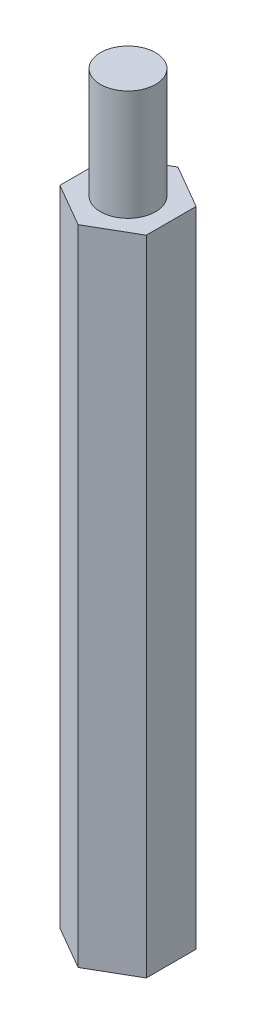
from build123d import *

# Parameters (mm, degrees)
BOSS_EXTRUDE1_DEPTH = 35
SKETCH2_R           = 1.5
BOSS_EXTRUDE2_DEPTH = 6
SKETCH5_R           = 1.5
CUT_EXTRUDE1_DEPTH  = 6


with BuildPart() as part:
    # Sketch1 → Boss-Extrude1 (new body)
    with BuildSketch(Plane(origin=(0, 0, 0), x_dir=(1, 0, 0), z_dir=(0, 1, 0))):
        Polygon((0, 2.713546265), (-2.35, 1.356773133), (-2.35, -1.356773133), (0, -2.713546265), (2.35, -1.356773133), (2.35, 1.356773133), align=None)
    extrude(amount=BOSS_EXTRUDE1_DEPTH)

    # Sketch2 → Boss-Extrude2 (add)
    with BuildSketch(Plane(origin=(0, 35, 0), x_dir=(1, 0, 0), z_dir=(0, 1, 0))):
        Circle(SKETCH2_R)
    extrude(amount=BOSS_EXTRUDE2_DEPTH)

    # Sketch5 → Cut-Extrude1 (cut)
    with BuildSketch(Plane.XZ):
        Circle(SKETCH5_R)
    extrude(amount=-CUT_EXTRUDE1_DEPTH, mode=Mode.SUBTRACT)


solid = part.part
